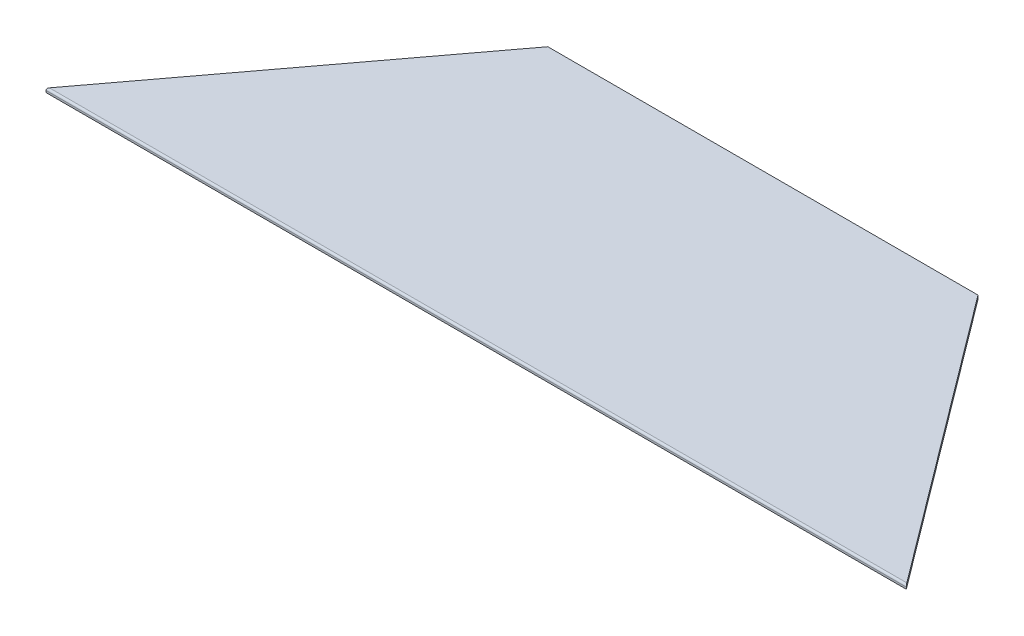
from build123d import *

# Parameters (mm, degrees)
BOSS_EXTRUDE1_DEPTH = 2.0574
FILLET1_R           = 1.0287


with BuildPart() as part:
    # Sketch1 → Boss-Extrude1 (new body)
    with BuildSketch(Plane(origin=(0, 0, 0), x_dir=(1, 0, 0), z_dir=(0, 1, 0))):
        Polygon((0, 0), (457.2, 0), (342.9, 152.4), (114.3, 152.4), align=None)
    extrude(amount=BOSS_EXTRUDE1_DEPTH)

    # Fillet1
    fillet1_edges = [part.edges().sort_by_distance(p)[0] for p in [
        (228.6, 2.0574, 0),
    ]]
    fillet(fillet1_edges, radius=FILLET1_R)


solid = part.part
